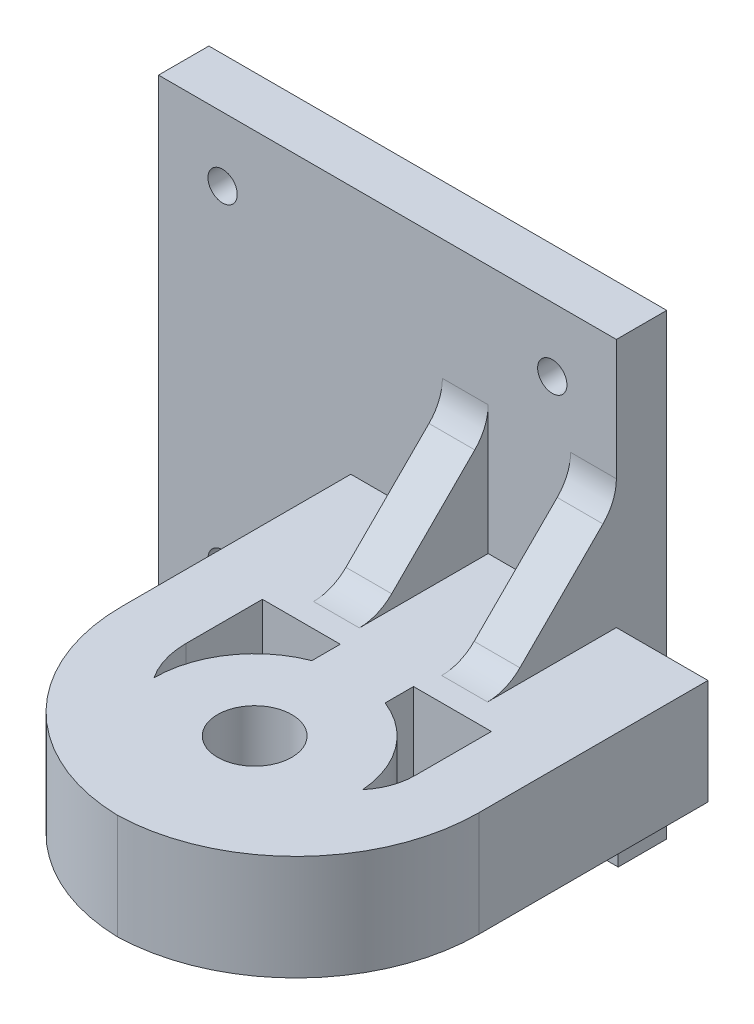
from build123d import *

# Parameters (mm, degrees)
SKETCH1_W           = 39
SKETCH1_H           = 45
BOSS_EXTRUDE1_DEPTH = 12.5
SKETCH2_R           = 4.05
CUT_EXTRUDE1_DEPTH  = 61.846117378
SKETCH3_W           = 50
SKETCH3_H           = 50
BOSS_EXTRUDE2_DEPTH = 5.5
BOSS_EXTRUDE3_START = -10
BOSS_EXTRUDE3_DEPTH = 5
LPATTERN1_COUNT     = 2
LPATTERN1_PITCH     = 14
FILLET1_R           = 5
SKETCH5_R           = 1.6
CUT_EXTRUDE2_DEPTH  = 76.175212005
FILLET2_R           = 20
CUT_EXTRUDE3_DEPTH  = 70.381643826
CUT_EXTRUDE4_START  = -1
SKETCH7_W           = 39
SKETCH7_H           = 50.063664736
SKETCH7_R           = 11
SKETCH7_W_2         = 11
SKETCH7_H_2         = 11
CUT_EXTRUDE4_DEPTH  = 1
SKETCH8_W           = 25
SKETCH8_H           = 5
SKETCH8_W_2         = 5
SKETCH8_H_2         = 25
BOSS_EXTRUDE4_DEPTH = 0.5
SKETCH9_W           = 34.8
SKETCH9_H           = 11.25
CUT_EXTRUDE5_DEPTH  = 0.2


with BuildPart() as part:
    # Sketch1 → Boss-Extrude1 (new body)
    with BuildSketch(Plane(origin=(0, 0, 0), x_dir=(1, 0, 0), z_dir=(0, 1, 0))):
        with Locations((19.5, 22.5)):
            Rectangle(SKETCH1_W, SKETCH1_H)
    extrude(amount=BOSS_EXTRUDE1_DEPTH)

    # Sketch2 → Cut-Extrude1 (cut, through all)
    with BuildSketch(Plane(origin=(0, 12.5, 0), x_dir=(1, 0, 0), z_dir=(0, 1, 0))):
        with Locations(Location((19.5, 15, 0), (0, 0, 270))):
            Circle(SKETCH2_R)
    extrude(amount=-CUT_EXTRUDE1_DEPTH, mode=Mode.SUBTRACT)

    # Sketch3 → Boss-Extrude2 (add)
    with BuildSketch(Plane(origin=(0, 0, -45), x_dir=(-1, 0, 0), z_dir=(0, 0, -1))):
        with Locations((-4, 14.75)):
            Rectangle(SKETCH3_W, SKETCH3_H)
    extrude(amount=BOSS_EXTRUDE2_DEPTH)

    # Sketch4 → Boss-Extrude3 (add)
    with BuildSketch(Plane(origin=(39, 0, 0), x_dir=(0, 0, -1), z_dir=(1, 0, 0)).offset(BOSS_EXTRUDE3_START)):
        Polygon((33, 12.5), (45, 24.5), (45, 12.5), align=None)
    boss_extrude3 = extrude(amount=-BOSS_EXTRUDE3_DEPTH)

    # LPattern1: Boss-Extrude3 ×2
    with Locations(*[(-i * LPATTERN1_PITCH, 0, 0) for i in range(1, LPATTERN1_COUNT)]):
        add(boss_extrude3)

    # Fillet1
    fillet1_edges = [part.edges().sort_by_distance(p)[0] for p in [
        (26.5, 12.5, -33),
        (26.5, 24.5, -45),
        (12.5, 12.5, -33),
        (12.5, 24.5, -45),
    ]]
    fillet(fillet1_edges, radius=FILLET1_R)

    # Sketch5 → Cut-Extrude2 (cut, through all)
    with BuildSketch(Plane(origin=(0, 0, -50.5), x_dir=(-1, 0, 0), z_dir=(0, 0, -1))):
        with Locations((-22, 32.75)):
            Circle(SKETCH5_R)
        with Locations((14, 32.75)):
            Circle(SKETCH5_R)
        with Locations((14, -3.25)):
            Circle(SKETCH5_R)
        with Locations((-22, -3.25)):
            Circle(SKETCH5_R)
    extrude(amount=-CUT_EXTRUDE2_DEPTH, mode=Mode.SUBTRACT)

    # Fillet2
    # the kernel refuses this fillet: 20 mm, written as the material it takes off along each edge
    with BuildSketch(Plane(origin=(0, -50, 0), x_dir=(0, 0, -1), z_dir=(0, 1, 0)), Plane(origin=(39, -50, 0), x_dir=(-1, 0, 0), z_dir=(0, 1, 0))) as fillet2_piece_1:
        with BuildLine():
            CenterArc((FILLET2_R, -FILLET2_R), FILLET2_R, 90, 90)
            Line((0, -FILLET2_R), (0, 0))
            Line((0, 0), (FILLET2_R, 0))
        make_face()
    extrude(amount=112.5, mode=Mode.SUBTRACT)

    # Sketch6 → Cut-Extrude3 (cut, through all)
    with BuildSketch(Plane(origin=(0, 12.5, 0), x_dir=(1, 0, 0), z_dir=(0, 1, 0))):
        with BuildLine():
            Line((7, 20), (7, 28.347560338))
            Line((7, 28.347560338), (15.5, 28.347560338))
            Line((15.5, 28.347560338), (15.5, 25.246950766))
            ThreePointArc((15.5, 25.246950766), (10.417048938, 21.204836823), (8.5, 15))
            ThreePointArc((8.5, 15), (7.383077909, 17.389923373), (7, 20))
        make_face()
        with BuildLine():
            Line((23.5, 25.246950766), (23.5, 28.347560338))
            Line((23.5, 28.347560338), (32, 28.347560338))
            Line((32, 28.347560338), (32, 20))
            ThreePointArc((32, 20), (31.605614865, 17.768951725), (30.47026085, 15.808317311))
            ThreePointArc((30.47026085, 15.808317311), (28.348679441, 21.534590434), (23.5, 25.246950766))
        make_face()
    extrude(amount=-CUT_EXTRUDE3_DEPTH, mode=Mode.SUBTRACT)

    # Sketch7 → Cut-Extrude4 (cut)
    with BuildSketch(Plane.XZ.offset(CUT_EXTRUDE4_START)):
        with Locations((19.5, -19.968167632)):
            Rectangle(SKETCH7_W, SKETCH7_H)
        with Locations(Location((19.5, -15, 0), (0, 0, 180))):
            Circle(SKETCH7_R, mode=Mode.SUBTRACT)
        with Locations((10, -37.501795484)):
            Rectangle(SKETCH7_W_2, SKETCH7_H_2, mode=Mode.SUBTRACT)
        with Locations((29, -37.501795484)):
            Rectangle(SKETCH7_W_2, SKETCH7_H_2, mode=Mode.SUBTRACT)
    extrude(amount=CUT_EXTRUDE4_DEPTH, mode=Mode.SUBTRACT)

    # Sketch8 → Boss-Extrude4 (add)
    with BuildSketch(Plane(origin=(0, 0, -50.5), x_dir=(-1, 0, 0), z_dir=(0, 0, -1))):
        with Locations((-4, 32.75)):
            Rectangle(SKETCH8_W, SKETCH8_H)
        with Locations((14, 14.75)):
            Rectangle(SKETCH8_W_2, SKETCH8_H_2)
        with Locations((-4, -3.25)):
            Rectangle(SKETCH8_W, SKETCH8_H)
        with Locations((-22, 14.75)):
            Rectangle(SKETCH8_W_2, SKETCH8_H_2)
    extrude(amount=BOSS_EXTRUDE4_DEPTH)

    # Sketch9 → Cut-Extrude5 (cut)
    with BuildSketch(Plane.XY.offset(-45)):
        with Locations((11.6, -4.625)):
            Rectangle(SKETCH9_W, SKETCH9_H)
    extrude(amount=-CUT_EXTRUDE5_DEPTH, mode=Mode.SUBTRACT)


solid = part.part
